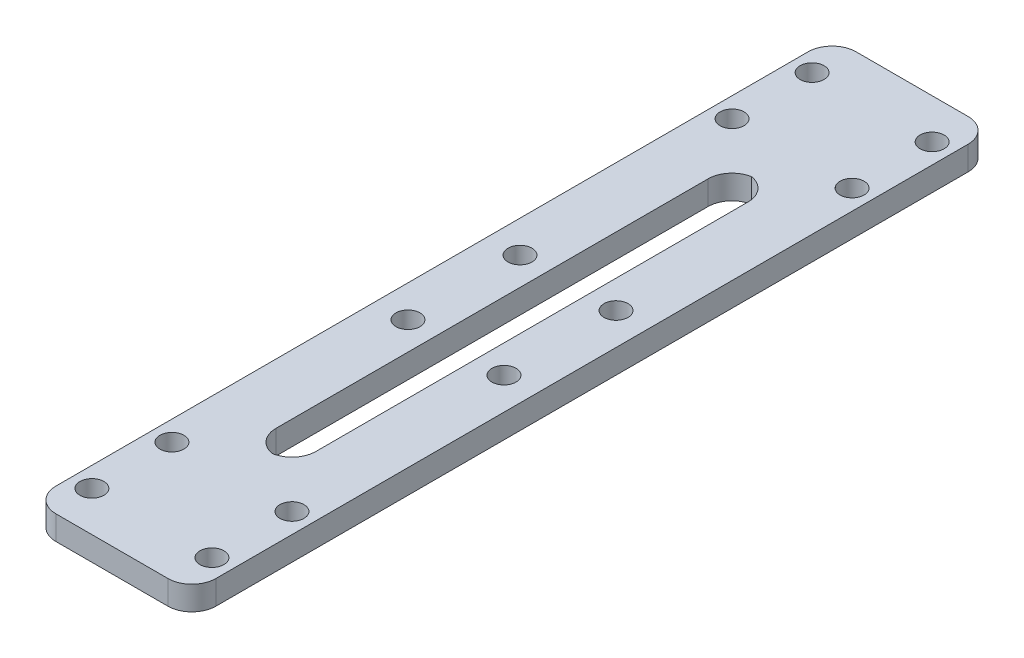
from build123d import *

# Parameters (mm, degrees)
SKETCH_1_W               = 20
SKETCH_1_H               = 100
EXTRUDE_1_DEPTH          = 3
SKETCH_2_R               = 1.5
CUT_EXTRUDE_1_DEPTH      = 52.078371156
CUT_EXTRUDE_2_DEPTH      = 52.078371156
CUT_EXTRUDE_2_DEPTH_BACK = 52.078371156
SKETCH_3_W               = 5
SKETCH_3_H               = 60
FILLET_1_R               = 3
FILLET_2_R               = 3
SKETCH_4_R               = 1.5
CUT_EXTRUDE_3_DEPTH      = 52.078371156


with BuildPart() as part:
    # 草图1 → 凸台-拉伸1 (new body)
    with BuildSketch(Plane(origin=(0, 0, 0), x_dir=(1, 0, 0), z_dir=(0, 1, 0))):
        Rectangle(SKETCH_1_W, SKETCH_1_H)
    extrude(amount=EXTRUDE_1_DEPTH)

    # 草图2 → 切除-拉伸1 (cut, through all)
    with BuildSketch(Plane(origin=(0, 3, 0), x_dir=(1, 0, 0), z_dir=(0, 1, 0))):
        with Locations(Location((-7.5, 45, 0), (0, 0, 270))):
            Circle(SKETCH_2_R)
        with Locations(Location((-7.5, 35, 0), (0, 0, 270))):
            Circle(SKETCH_2_R)
        with Locations(Location((7.5, 45, 0), (0, 0, 90))):
            Circle(SKETCH_2_R)
        with Locations(Location((7.5, 35, 0), (0, 0, 90))):
            Circle(SKETCH_2_R)
        with Locations(Location((7.5, -35, 0), (0, 0, 270))):
            Circle(SKETCH_2_R)
        with Locations(Location((7.5, -45, 0), (0, 0, 270))):
            Circle(SKETCH_2_R)
        with Locations(Location((-7.5, -35, 0), (0, 0, 90))):
            Circle(SKETCH_2_R)
        with Locations(Location((-7.5, -45, 0), (0, 0, 90))):
            Circle(SKETCH_2_R)
    extrude(amount=-CUT_EXTRUDE_1_DEPTH, mode=Mode.SUBTRACT)

    # 草图3 → 切除-拉伸2 (cut, two sides: drawn at the far end of the back side and taken through both)
    with BuildSketch(Plane(origin=(0, 3, 0), x_dir=(1, 0, 0), z_dir=(0, 1, 0)).offset(-CUT_EXTRUDE_2_DEPTH_BACK)):
        Rectangle(SKETCH_3_W, SKETCH_3_H)
    extrude(amount=CUT_EXTRUDE_2_DEPTH + CUT_EXTRUDE_2_DEPTH_BACK, mode=Mode.SUBTRACT)

    # 圆角1
    # the kernel refuses this fillet: 3 mm, written as the material it adds along each edge
    with BuildSketch(Plane(origin=(-2.5, 3, -30), x_dir=(1, 0, 0), z_dir=(0, -1, 0)), Plane(origin=(-2.5, 3, 30), x_dir=(0, 0, -1), z_dir=(0, -1, 0)), Plane(origin=(2.5, 0, 30), x_dir=(0, 0, -1), z_dir=(0, 1, 0))) as fillet_1_piece_1:
        with BuildLine():
            CenterArc((FILLET_1_R, FILLET_1_R), FILLET_1_R, 180, 90)
            Line((0, FILLET_1_R), (0, 0))
            Line((0, 0), (FILLET_1_R, 0))
        make_face()
    extrude(amount=3)
    with BuildSketch(Plane(origin=(2.5, 0, -30), x_dir=(0, 0, 1), z_dir=(0, 1, 0))) as fillet_1_piece_2:
        with BuildLine():
            CenterArc((FILLET_1_R, -FILLET_1_R), FILLET_1_R, 90, 90)
            Line((0, -FILLET_1_R), (0, 0))
            Line((0, 0), (FILLET_1_R, 0))
        make_face()
    extrude(amount=3)

    # 圆角2
    fillet_2_edges = [part.edges().sort_by_distance(p)[0] for p in [
        (10, 1.5, 50),
        (-10, 1.5, 50),
        (-10, 1.5, -50),
        (10, 1.5, -50),
    ]]
    fillet(fillet_2_edges, radius=FILLET_2_R)

    # 草图4 → 切除-拉伸3 (cut, through all)
    with BuildSketch(Plane(origin=(0, 3, 0), x_dir=(1, 0, 0), z_dir=(0, 1, 0))):
        with Locations(Location((-6, 7, 0), (0, 0, 270))):
            Circle(SKETCH_4_R)
        with Locations(Location((6, 7, 0), (0, 0, 90))):
            Circle(SKETCH_4_R)
        with Locations(Location((6, -7, 0), (0, 0, 270))):
            Circle(SKETCH_4_R)
        with Locations(Location((-6, -7, 0), (0, 0, 90))):
            Circle(SKETCH_4_R)
    extrude(amount=-CUT_EXTRUDE_3_DEPTH, mode=Mode.SUBTRACT)


solid = part.part
